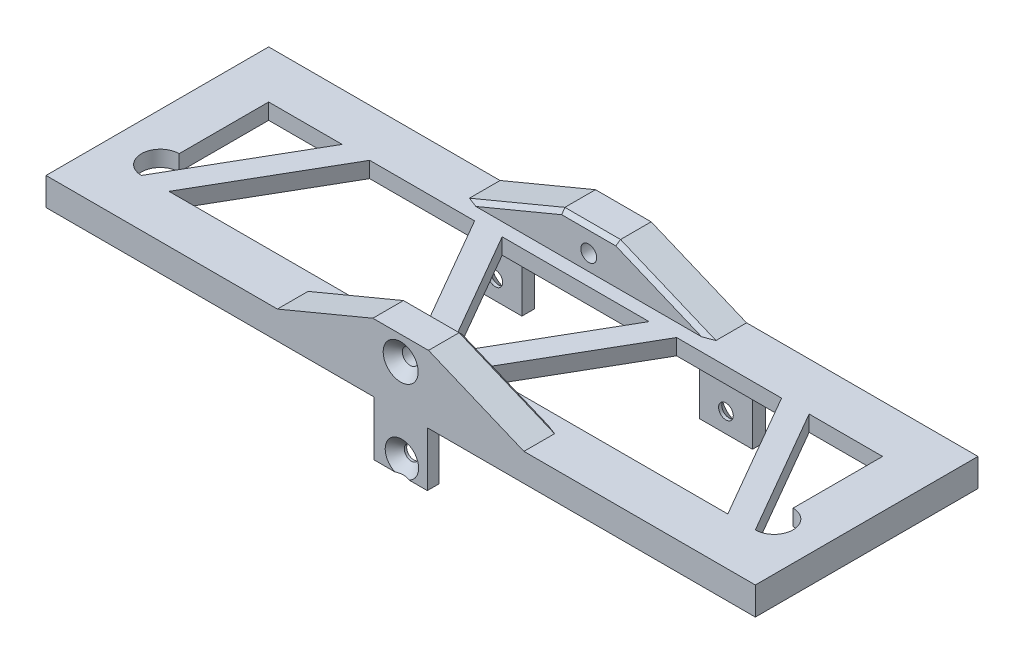
from build123d import *

# Parameters (mm, degrees)
SKETCH1_W           = 89.2
SKETCH1_H           = 28
BOSS_EXTRUDE1_DEPTH = 2
SKETCH3_W           = 89.2
SKETCH3_H           = 28
SKETCH3_W_2         = 85.2
SKETCH3_H_2         = 24
BOSS_EXTRUDE2_DEPTH = 1.5
CUT_EXTRUDE1_REACH  = 48.788
SKETCH5_W           = 7
SKETCH5_H           = 4.35
BOSS_EXTRUDE3_DEPTH = 5
SKETCH6_R           = 1
CUT_EXTRUDE2_DEPTH  = 54.124005873
BOSS_EXTRUDE4_DEPTH = 4.35
BOSS_EXTRUDE5_DEPTH = 4.35
CHAMFER1_SIZE       = 1.2
CHAMFER2_SIZE       = 1.2
SKETCH9_W           = 6.7
SKETCH9_H           = 6.85
BOSS_EXTRUDE6_DEPTH = 1.5
SKETCH15_W          = 6.7
SKETCH15_H          = 1.6
BOSS_EXTRUDE7_DEPTH = 8.3
CUT_EXTRUDE9_REACH  = 55.565
SKETCH16_R          = 0.925
CUT_EXTRUDE11_REACH = 55.565
SKETCH17_R          = 0.9
CHAMFER3_SIZE       = 1.2
CHAMFER4_SIZE       = 1.2
CUT_EXTRUDE12_DEPTH = 48.76190951
CHAMFER5_SIZE       = 0.5
CHAMFER6_SIZE       = 0.5


with BuildPart() as part:
    # Sketch1 → Boss-Extrude1 (new body)
    with BuildSketch(Plane(origin=(0, 0, 0), x_dir=(1, 0, 0), z_dir=(0, 1, 0))):
        Rectangle(SKETCH1_W, SKETCH1_H)
    extrude(amount=BOSS_EXTRUDE1_DEPTH)

    # Sketch3 → Boss-Extrude2 (add)
    with BuildSketch(Plane.XZ):
        Rectangle(SKETCH3_W, SKETCH3_H)
        Rectangle(SKETCH3_W_2, SKETCH3_H_2, mode=Mode.SUBTRACT)
    extrude(amount=BOSS_EXTRUDE2_DEPTH)

    # Sketch4 → Cut-Extrude1 (cut, up to next)
    with BuildSketch(Plane.XZ, mode=Mode.PRIVATE) as cut_extrude1_sk1:
        Polygon((38.6, -8), (38.6, 8), (29.362395693, -8), align=None)
    cut_extrude1_tool1 = extrude(cut_extrude1_sk1.sketch, amount=-CUT_EXTRUDE1_REACH, mode=Mode.PRIVATE) & part.part
    # Sketch4 → Cut-Extrude1 (cut, up to next)
    with BuildSketch(Plane.XZ, mode=Mode.PRIVATE) as cut_extrude1_sk2:
        Polygon((35.135898385, 8), (3.464101615, 8), (12.701705922, -8), (25.898294078, -8), align=None)
    cut_extrude1_tool2 = extrude(cut_extrude1_sk2.sketch, amount=-CUT_EXTRUDE1_REACH, mode=Mode.PRIVATE) & part.part
    # Sketch4 → Cut-Extrude1 (cut, up to next)
    with BuildSketch(Plane.XZ, mode=Mode.PRIVATE) as cut_extrude1_sk3:
        Polygon((-38.6, 8), (-38.6, -8), (-29.362395693, -8), align=None)
    cut_extrude1_tool3 = extrude(cut_extrude1_sk3.sketch, amount=-CUT_EXTRUDE1_REACH, mode=Mode.PRIVATE) & part.part
    # Sketch4 → Cut-Extrude1 (cut, up to next)
    with BuildSketch(Plane.XZ, mode=Mode.PRIVATE) as cut_extrude1_sk4:
        Polygon((0, 8), (-9.237604307, -8), (9.237604307, -8), align=None)
    cut_extrude1_tool4 = extrude(cut_extrude1_sk4.sketch, amount=-CUT_EXTRUDE1_REACH, mode=Mode.PRIVATE) & part.part
    # Sketch4 → Cut-Extrude1 (cut, up to next)
    with BuildSketch(Plane.XZ, mode=Mode.PRIVATE) as cut_extrude1_sk5:
        Polygon((-3.464101615, 8), (-12.701705922, -8), (-25.898294078, -8), (-35.135898385, 8), align=None)
    cut_extrude1_tool5 = extrude(cut_extrude1_sk5.sketch, amount=-CUT_EXTRUDE1_REACH, mode=Mode.PRIVATE) & part.part
    add(cut_extrude1_tool1.solids().sort_by_distance((35.520799, 0, -2.666667))[0], mode=Mode.SUBTRACT)
    add(cut_extrude1_tool2.solids().sort_by_distance((19.3, 0, 1.098039))[0], mode=Mode.SUBTRACT)
    add(cut_extrude1_tool3.solids().sort_by_distance((-35.520799, 0, -2.666667))[0], mode=Mode.SUBTRACT)
    add(cut_extrude1_tool4.solids().sort_by_distance((0, 0, -2.666667))[0], mode=Mode.SUBTRACT)
    add(cut_extrude1_tool5.solids().sort_by_distance((-19.3, 0, 1.098039))[0], mode=Mode.SUBTRACT)

    # Sketch5 → Boss-Extrude3 (add)
    with BuildSketch(Plane(origin=(0, 2, 0), x_dir=(1, 0, 0), z_dir=(0, 1, 0))):
        with Locations((0, 11.825)):
            Rectangle(SKETCH5_W, SKETCH5_H)
        with Locations((0, -11.825)):
            Rectangle(SKETCH5_W, SKETCH5_H)
    extrude(amount=BOSS_EXTRUDE3_DEPTH)

    # Sketch6 → Cut-Extrude2 (cut, through all)
    with BuildSketch(Plane.XY.offset(14)):
        with Locations((0, 4)):
            Circle(SKETCH6_R)
    extrude(amount=-CUT_EXTRUDE2_DEPTH, mode=Mode.SUBTRACT)

    # Sketch7 → Boss-Extrude4 (add)
    with BuildSketch(Plane.XY.offset(14)):
        Polygon((3.5, 7), (3.5, 2), (15.5, 2), align=None)
        Polygon((-3.5, 7), (-3.5, 2), (-15.5, 2), align=None)
    extrude(amount=-BOSS_EXTRUDE4_DEPTH)

    # Sketch8 → Boss-Extrude5 (add)
    with BuildSketch(Plane(origin=(0, 0, -14), x_dir=(-1, 0, 0), z_dir=(0, 0, -1))):
        Polygon((3.5, 7), (3.5, 2), (15.5, 2), align=None)
        Polygon((-3.5, 7), (-3.5, 2), (-15.5, 2), align=None)
    extrude(amount=-BOSS_EXTRUDE5_DEPTH)

    # Chamfer1
    chamfer1_edges = [part.edges().sort_by_distance(p)[0] for p in [
        (-1, 4, -14),
    ]]
    chamfer(chamfer1_edges, length=CHAMFER1_SIZE)

    # Chamfer2
    chamfer2_edges = [part.edges().sort_by_distance(p)[0] for p in [
        (-1, 4, 14),
    ]]
    chamfer(chamfer2_edges, length=CHAMFER2_SIZE)

    # Sketch9 → Boss-Extrude6 (add)
    with BuildSketch(Plane.XY.offset(14)):
        with Locations((0, -4.925)):
            Rectangle(SKETCH9_W, SKETCH9_H)
    extrude(amount=-BOSS_EXTRUDE6_DEPTH)

    # Sketch15 → Boss-Extrude7 (add)
    with BuildSketch(Plane.XZ.offset(1.5)):
        with Locations((14.5, -13.2)):
            Rectangle(SKETCH15_W, SKETCH15_H)
        with Locations((-14.5, -13.2)):
            Rectangle(SKETCH15_W, SKETCH15_H)
    extrude(amount=BOSS_EXTRUDE7_DEPTH)

    # Sketch16 → Cut-Extrude9 (cut, up to next)
    with BuildSketch(Plane(origin=(0, 0, -14), x_dir=(-1, 0, 0), z_dir=(0, 0, -1)), mode=Mode.PRIVATE) as cut_extrude9_sk1:
        with Locations((14.5, -7.35)):
            Circle(SKETCH16_R)
    cut_extrude9_tool1 = extrude(cut_extrude9_sk1.sketch, amount=-CUT_EXTRUDE9_REACH, mode=Mode.PRIVATE) & part.part
    # Sketch16 → Cut-Extrude9 (cut, up to next)
    with BuildSketch(Plane(origin=(0, 0, -14), x_dir=(-1, 0, 0), z_dir=(0, 0, -1)), mode=Mode.PRIVATE) as cut_extrude9_sk2:
        with Locations((-14.5, -7.35)):
            Circle(SKETCH16_R)
    cut_extrude9_tool2 = extrude(cut_extrude9_sk2.sketch, amount=-CUT_EXTRUDE9_REACH, mode=Mode.PRIVATE) & part.part
    add(cut_extrude9_tool1.solids().sort_by_distance((-14.5, -7.35, -14))[0], mode=Mode.SUBTRACT)
    add(cut_extrude9_tool2.solids().sort_by_distance((14.5, -7.35, -14))[0], mode=Mode.SUBTRACT)

    # Sketch17 → Cut-Extrude11 (cut, up to next)
    with BuildSketch(Plane.XY.offset(14), mode=Mode.PRIVATE) as cut_extrude11_sk1:
        with Locations((0.155335946, -6.45)):
            Circle(SKETCH17_R)
    cut_extrude11_tool1 = extrude(cut_extrude11_sk1.sketch, amount=-CUT_EXTRUDE11_REACH, mode=Mode.PRIVATE) & part.part
    add(cut_extrude11_tool1.solids().sort_by_distance((0.155336, -6.45, 14))[0], mode=Mode.SUBTRACT)

    # Chamfer3
    # the kernel refuses this chamfer: 1.2 mm, written as the material it takes off along each edge
    with BuildSketch(Plane(origin=(0.155335946, -6.45, 14), x_dir=(1, 0, 0), z_dir=(0, -1, 0))) as chamfer3_piece_1:
        Polygon((0.9 + CHAMFER3_SIZE, 0), (0.9, -CHAMFER3_SIZE), (0.9, 0), align=None)
    revolve(axis=Axis((0.155335946, -6.45, 14), (0, 0, 1)), mode=Mode.SUBTRACT)

    # Chamfer4
    chamfer4_edges = [part.edges().sort_by_distance(p)[0] for p in [
        (-13.575, -7.35, -14),
        (15.425, -7.35, -14),
    ]]
    chamfer(chamfer4_edges, length=CHAMFER4_SIZE)

    # Sketch18 → Cut-Extrude12 (cut, through all)
    with BuildSketch(Plane.XZ):
        with BuildLine():
            Line((38.6, 3.26), (38.6, 8))
            ThreePointArc((38.6, 8), (40.97, 5.63), (38.6, 3.26))
        make_face()
        with BuildLine():
            Line((-38.6, 8), (-38.6, 3.257907009))
            ThreePointArc((-38.6, 3.257907009), (-40.971046495, 5.628953505), (-38.6, 8))
        make_face()
    extrude(amount=-CUT_EXTRUDE12_DEPTH, mode=Mode.SUBTRACT)

    # Chamfer5
    chamfer5_edges = [part.edges().sort_by_distance(p)[0] for p in [
        (0, 7, -9.65),
        (-9.5, 4.5, -9.65),
        (9.5, 4.5, -9.65),
    ]]
    chamfer(chamfer5_edges, length=CHAMFER5_SIZE)

    # Chamfer6
    chamfer6_edges = [part.edges().sort_by_distance(p)[0] for p in [
        (0, 7, 9.65),
        (9.5, 4.5, 9.65),
        (-9.5, 4.5, 9.65),
    ]]
    chamfer(chamfer6_edges, length=CHAMFER6_SIZE)


solid = part.part
